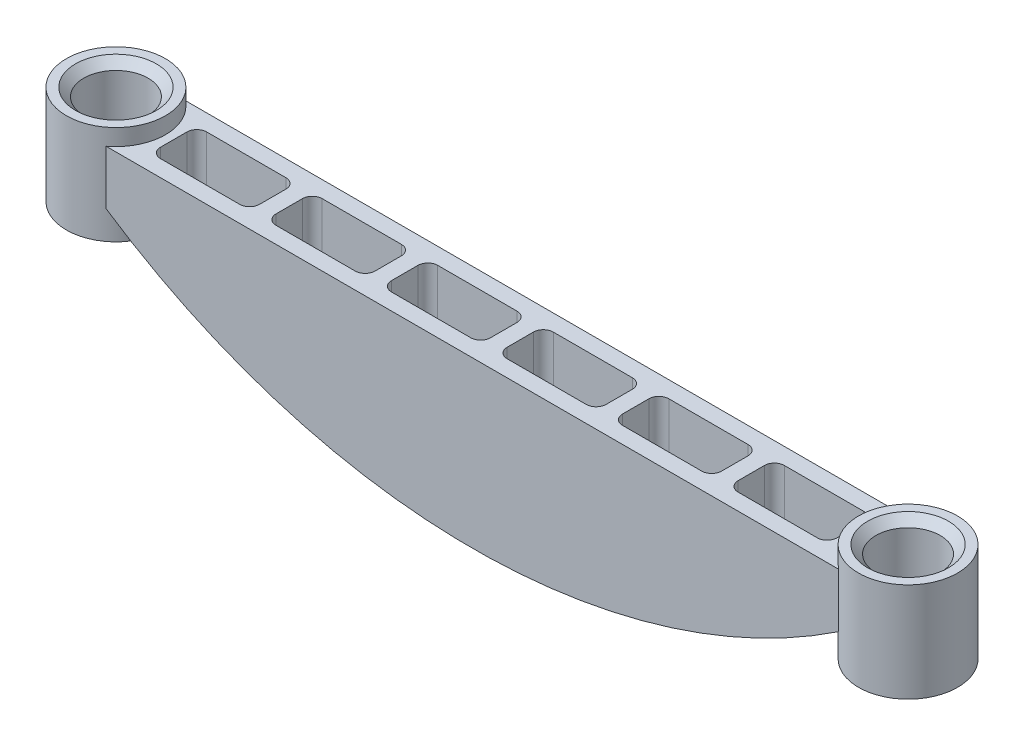
from build123d import *

# Parameters (mm, degrees)
EXTRUDE_1_DEPTH              = 12
EXTRUDE_START                = 5
SKETCH_2_R                   = 15
EXTRUDE_2_DEPTH              = 30
HOLE_WIZARD_M221_D           = 19.5
HOLE_WIZARD_M221_CSINK_D     = 24.5
HOLE_WIZARD_M221_CSINK_ANGLE = 90
CUT_EXTRUDE_1_REACH          = 146.741
CUT_EXTRUDE_1_END_RADIUS     = 195
PATTERN_START                = -41.360262435
PATTERN_LINEAR_1_DEPTH       = 41.360262435
PATTERN_START_2              = -31.021407683
PATTERN_LINEAR_1_2_DEPTH     = 31.021407683
PATTERN_START_3              = -44.9839738
PATTERN_LINEAR_1_3_DEPTH     = 4.236103563
PATTERN_START_4              = -7
PATTERN_LINEAR_1_4_DEPTH     = 14


with BuildPart() as part:
    # Эскиз1 → Бобышка-Вытянуть1 (new, symmetric)
    with BuildSketch(Plane.XY):
        with BuildLine():
            Line((120, 0), (-120, 0))
            Line((-120, 0), (-120, -10))
            ThreePointArc((-120, -10), (0, -50), (120, -10))
            Line((120, -10), (120, 0))
        make_face()
    extrude(amount=EXTRUDE_1_DEPTH, both=True)

    # Эскиз2 → Бобышка-Вытянуть2 (add)
    with BuildSketch(Plane(origin=(0, 0, 0), x_dir=(1, 0, 0), z_dir=(0, 1, 0)).offset(EXTRUDE_START)):
        with Locations(Location((-120, 0, 0), (0, 0, 270))):
            Circle(SKETCH_2_R)
        with Locations(Location((120, 0, 0), (0, 0, 90))):
            Circle(SKETCH_2_R)
    extrude(amount=-EXTRUDE_2_DEPTH)

    # Отверстие обработанное метчиком M221 (through all)
    with Locations(Plane(origin=(0, 5, 0), x_dir=(1, 0, 0), z_dir=(0, 1, 0))):
        with Locations((-120, 0), (120, 0)):
            CounterSinkHole(HOLE_WIZARD_M221_D / 2, HOLE_WIZARD_M221_CSINK_D / 2, counter_sink_angle=HOLE_WIZARD_M221_CSINK_ANGLE)

    # Вырез-Вытянуть1: up to this cylinder (the profile starts inside it)
    cut_extrude_1_end = Plane(origin=(0, 150, 0), z_dir=(0, 0, -1)) * Cylinder(CUT_EXTRUDE_1_END_RADIUS, 684.482, mode=Mode.PRIVATE)
    # Эскиз5 → Вырез-Вытянуть1 (cut, up to the surface)
    with BuildSketch(Plane(origin=(0, 0, 0), x_dir=(1, 0, 0), z_dir=(0, 1, 0)), mode=Mode.PRIVATE) as cut_extrude_1_sk1:
        with BuildLine():
            Line((-99.5, -7), (-75.5, -7))
            ThreePointArc((-75.5, -7), (-73.378679656, -6.121320344), (-72.5, -4))
            Line((-72.5, -4), (-72.5, 4))
            ThreePointArc((-72.5, 4), (-73.378679656, 6.121320344), (-75.5, 7))
            Line((-75.5, 7), (-99.5, 7))
            ThreePointArc((-99.5, 7), (-101.621320344, 6.121320344), (-102.5, 4))
            Line((-102.5, 4), (-102.5, -4))
            ThreePointArc((-102.5, -4), (-101.621320344, -6.121320344), (-99.5, -7))
        make_face()
    cut_extrude_1_tool1 = extrude(cut_extrude_1_sk1.sketch, amount=-CUT_EXTRUDE_1_REACH, mode=Mode.PRIVATE) & cut_extrude_1_end
    add(cut_extrude_1_tool1.solids().sort_by_distance((-87.5, 0, 0))[0], mode=Mode.SUBTRACT)

    # Линейный массив1: read off the stored shape, not the designer's step
    # Линейный массив1 outline → Линейный массив1 (cut)
    with BuildSketch(Plane(origin=(0, 0, 0), x_dir=(1, 0, 0), z_dir=(0, 1, 0)).offset(PATTERN_START)):
        with BuildLine():
            ThreePointArc((37.5, -4), (38.378679656, -6.121320344), (40.5, -7))
            Line((40.5, -7), (64.5, -7))
            ThreePointArc((64.5, -7), (66.621320344, -6.121320344), (67.5, -4))
            Line((67.5, -4), (67.5, 4))
            ThreePointArc((67.5, 4), (66.621320344, 6.121320344), (64.5, 7))
            Line((64.5, 7), (40.5, 7))
            ThreePointArc((40.5, 7), (38.378679656, 6.121320344), (37.5, 4))
            Line((37.5, 4), (37.5, -4))
        make_face()
        with BuildLine():
            ThreePointArc((2.5, -4), (3.378679656, -6.121320344), (5.5, -7))
            Line((5.5, -7), (29.5, -7))
            ThreePointArc((29.5, -7), (31.621320344, -6.121320344), (32.5, -4))
            Line((32.5, -4), (32.5, 4))
            ThreePointArc((32.5, 4), (31.621320344, 6.121320344), (29.5, 7))
            Line((29.5, 7), (5.5, 7))
            ThreePointArc((5.5, 7), (3.378679656, 6.121320344), (2.5, 4))
            Line((2.5, 4), (2.5, -4))
        make_face()
        with BuildLine():
            ThreePointArc((-32.5, -4), (-31.621320344, -6.121320344), (-29.5, -7))
            Line((-29.5, -7), (-5.5, -7))
            ThreePointArc((-5.5, -7), (-3.378679656, -6.121320344), (-2.5, -4))
            Line((-2.5, -4), (-2.5, 4))
            ThreePointArc((-2.5, 4), (-3.378679656, 6.121320344), (-5.5, 7))
            Line((-5.5, 7), (-29.5, 7))
            ThreePointArc((-29.5, 7), (-31.621320344, 6.121320344), (-32.5, 4))
            Line((-32.5, 4), (-32.5, -4))
        make_face()
        with BuildLine():
            ThreePointArc((-67.5, -4), (-66.621320344, -6.121320344), (-64.5, -7))
            Line((-64.5, -7), (-40.5, -7))
            ThreePointArc((-40.5, -7), (-38.378679656, -6.121320344), (-37.5, -4))
            Line((-37.5, -4), (-37.5, 4))
            ThreePointArc((-37.5, 4), (-38.378679656, 6.121320344), (-40.5, 7))
            Line((-40.5, 7), (-64.5, 7))
            ThreePointArc((-64.5, 7), (-66.621320344, 6.121320344), (-67.5, 4))
            Line((-67.5, 4), (-67.5, -4))
        make_face()
    extrude(amount=PATTERN_LINEAR_1_DEPTH, mode=Mode.SUBTRACT)

    # Pattern Linear 1 2 outline → Pattern Linear 1 2 (cut)
    with BuildSketch(Plane(origin=(0, 0, 0), x_dir=(1, 0, 0), z_dir=(0, 1, 0)).offset(PATTERN_START_2)):
        with BuildLine():
            ThreePointArc((72.5, -4), (73.378679656, -6.121320344), (75.5, -7))
            Line((75.5, -7), (99.5, -7))
            ThreePointArc((99.5, -7), (101.621320344, -6.121320344), (102.5, -4))
            Line((102.5, -4), (102.5, 4))
            ThreePointArc((102.5, 4), (101.621320344, 6.121320344), (99.5, 7))
            Line((99.5, 7), (75.5, 7))
            ThreePointArc((75.5, 7), (73.378679656, 6.121320344), (72.5, 4))
            Line((72.5, 4), (72.5, -4))
        make_face()
    extrude(amount=PATTERN_LINEAR_1_2_DEPTH, mode=Mode.SUBTRACT)

    # Pattern Linear 1 3 outline → Pattern Linear 1 3 (cut)
    with BuildSketch(Plane(origin=(0, 0, 0), x_dir=(1, 0, 0), z_dir=(0, 1, 0)).offset(PATTERN_START_3)):
        with BuildLine():
            ThreePointArc((2.5, -4), (3.378679656, -6.121320344), (5.5, -7))
            Line((5.5, -7), (29.5, -7))
            ThreePointArc((29.5, -7), (31.621320344, -6.121320344), (32.5, -4))
            Line((32.5, -4), (32.5, 4))
            ThreePointArc((32.5, 4), (31.621320344, 6.121320344), (29.5, 7))
            Line((29.5, 7), (5.5, 7))
            ThreePointArc((5.5, 7), (3.378679656, 6.121320344), (2.5, 4))
            Line((2.5, 4), (2.5, -4))
        make_face()
        with BuildLine():
            ThreePointArc((-32.5, -4), (-31.621320344, -6.121320344), (-29.5, -7))
            Line((-29.5, -7), (-5.5, -7))
            ThreePointArc((-5.5, -7), (-3.378679656, -6.121320344), (-2.5, -4))
            Line((-2.5, -4), (-2.5, 4))
            ThreePointArc((-2.5, 4), (-3.378679656, 6.121320344), (-5.5, 7))
            Line((-5.5, 7), (-29.5, 7))
            ThreePointArc((-29.5, 7), (-31.621320344, 6.121320344), (-32.5, 4))
            Line((-32.5, 4), (-32.5, -4))
        make_face()
    extrude(amount=PATTERN_LINEAR_1_3_DEPTH, mode=Mode.SUBTRACT)

    # Pattern Linear 1 4 outline → Pattern Linear 1 4 (add)
    with BuildSketch(Plane.XY.offset(PATTERN_START_4)):
        with BuildLine():
            ThreePointArc((-67.5, -38.265105636), (-62.843316415, -39.870265134), (-58.148516411, -41.360262435))
            Line((-58.148516411, -41.360262435), (-37.499997451, -41.360262832))
            ThreePointArc((-37.499997451, -41.360262832), (-52.668355018, -37.752614841), (-67.500003279, -32.944662555))
            Line((-67.500003279, -32.944662555), (-67.5, -38.265105636))
        make_face()
        with BuildLine():
            ThreePointArc((58.148516411, -41.360262435), (62.843316414, -39.870265134), (67.5, -38.265105635))
            Line((67.5, -38.265105635), (67.500003279, -32.944662555))
            ThreePointArc((67.500003279, -32.944662555), (52.668355018, -37.752614841), (37.499997451, -41.360262832))
            Line((37.499997451, -41.360262832), (58.148516411, -41.360262435))
        make_face()
        with BuildLine():
            ThreePointArc((85.036756526, -31.021407683), (93.883208046, -26.595422497), (102.5, -21.737444956))
            Line((102.5, -21.737444956), (102.500004682, -15.887760369))
            ThreePointArc((102.500004682, -15.887760369), (87.82657312, -24.101961661), (72.499996647, -31.021408916))
            Line((72.499996647, -31.021408916), (85.036756526, -31.021407683))
        make_face()
        with BuildLine():
            Line((32.5, -44.9839738), (32.500002516, -42.272592525))
            ThreePointArc((32.500002516, -42.272592525), (17.552432542, -44.20842441), (2.499996976, -44.983973739))
            Line((2.499996976, -44.983973739), (32.5, -44.9839738))
        make_face()
        with BuildLine():
            Line((-32.5, -44.9839738), (-2.499996976, -44.983973739))
            ThreePointArc((-2.499996976, -44.983973739), (-17.552432542, -44.20842441), (-32.500002516, -42.272592525))
            Line((-32.500002516, -42.272592525), (-32.5, -44.9839738))
        make_face()
    extrude(amount=PATTERN_LINEAR_1_4_DEPTH)


solid = part.part
